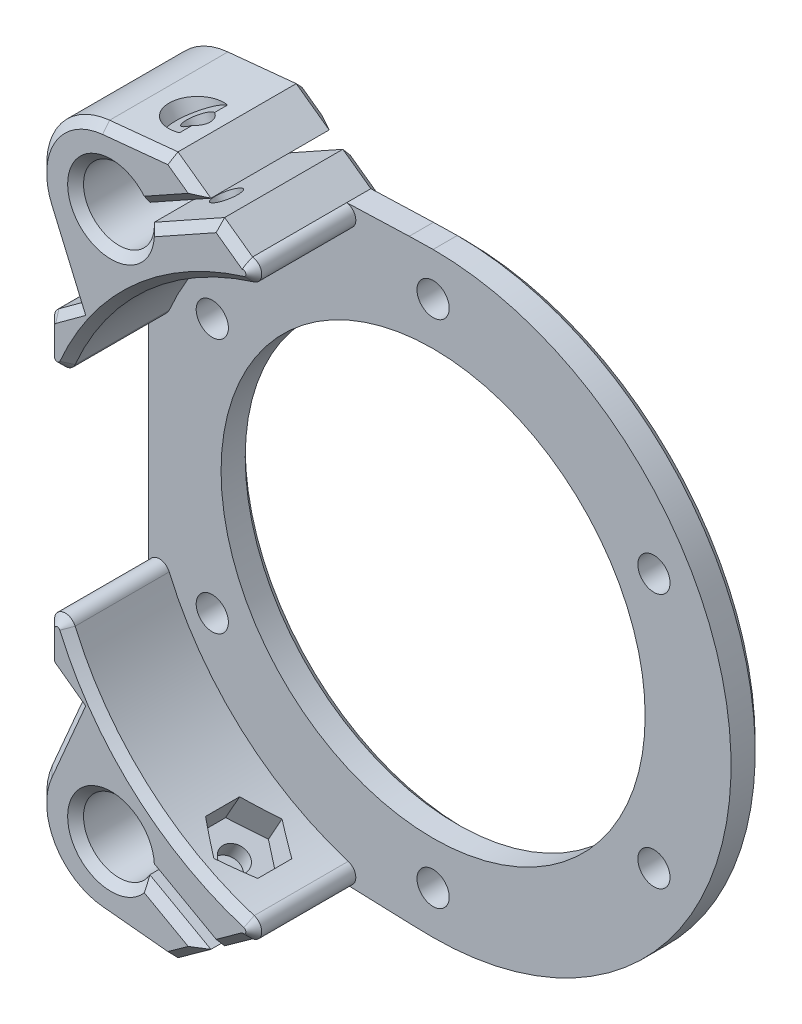
from build123d import *

# Parameters (mm, degrees)
SKETCH1_R           = 3.0000000000000004
SKETCH1_R_2         = 19.75
SKETCH1_R_3         = 19.749999999999996
BOSS_EXTRUDE1_DEPTH = 3
CUT_EXTRUDE1_DEPTH  = 85.92239104029044
SKETCH3_R           = 3.2999999999999914
BOSS_EXTRUDE2_DEPTH = 3
FILLET1_R           = 6.5
SKETCH4_R           = 1.5000000000000042
SKETCH4_R_2         = 1.4999999999999973
SKETCH4_R_3         = 1.5000000000000009
CUT_EXTRUDE2_DEPTH  = 86.57976596763909
SKETCH5_W           = 197.96063853035466
SKETCH5_H           = 105.83016834927265
CUT_EXTRUDE3_DEPTH  = 86.57976596763909
SKETCH6_R           = 3.2999999999999914
BOSS_EXTRUDE3_DEPTH = 9.5
FILLET2_R           = 1
CUT_EXTRUDE4_DEPTH  = 85.71619587231169
CUT_EXTRUDE5_START  = 10
SKETCH8_R           = 1.2000000000000004
CUT_EXTRUDE5_DEPTH  = 18.00000000000001
CUT_EXTRUDE6_START  = 10
SKETCH9_R           = 2.3249999999999984
CUT_EXTRUDE6_DEPTH  = 4.5
CUT_EXTRUDE7_START  = -5
CUT_EXTRUDE7_DEPTH  = 3.5
CHAMFER1_SIZE       = 0.75
CHAMFER2_SIZE       = 0.74


with BuildPart() as part:
    # Sketch1 → Boss-Extrude1 (new body)
    with BuildSketch(Plane.XY):
        Polygon((0, 36.75), (-10.000000000000002, 33.333681382493936), (-15.000000000000002, 29.000000000000007), (-58.050000000000004, 27.499999999999993), (-76.5, 14), (-76.5, -14), (-58.050000000000004, -27.500000000000007), (-14.999999999999998, -28.999999999999993), (-9.99999999999998, -33.333681382493936), (0, -36.75), (9.999999999999998, -33.333681382493936), (15.000000000000002, -28.999999999999996), (58.050000000000004, -27.500000000000007), (76.5, -14), (76.5, 14), (58.050000000000004, 27.499999999999993), (14.999999999999998, 29.000000000000007), (9.999999999999998, 33.333681382493936), align=None)
        with Locations((0, 30)):
            Circle(SKETCH1_R, mode=Mode.SUBTRACT)
        with Locations((-49.99999999999999, 0)):
            Circle(SKETCH1_R_2, mode=Mode.SUBTRACT)
        with Locations(Location((50.00000000000001, 1.225e-14, 0), (0, 0, 180))):
            Circle(SKETCH1_R_3, mode=Mode.SUBTRACT)
        with Locations(Location((0, -30, 0), (0, 0, 180))):
            Circle(SKETCH1_R, mode=Mode.SUBTRACT)
    extrude(amount=BOSS_EXTRUDE1_DEPTH)

    # Sketch2 → Cut-Extrude1 (cut, through all)
    with BuildSketch(Plane.XY.offset(3)):
        with BuildLine():
            Line((8.5, 20.000000000000007), (-8.5, 20))
            ThreePointArc((-8.5, 20), (-11.32842712474619, 18.82842712474619), (-12.5, 16))
            Line((-12.5, 16), (-12.499999999999996, -16))
            ThreePointArc((-12.499999999999996, -16), (-11.328427124746181, -18.828427124746188), (-8.499999999999993, -19.999999999999996))
            Line((-8.499999999999993, -19.999999999999996), (8.500000000000007, -19.999999999999996))
            ThreePointArc((8.500000000000007, -19.999999999999996), (11.328427124746195, -18.828427124746185), (12.500000000000004, -15.999999999999996))
            Line((12.500000000000004, -15.999999999999996), (12.5, 16.000000000000004))
            ThreePointArc((12.5, 16.000000000000004), (11.328427124746193, 18.828427124746195), (8.5, 20.000000000000007))
        make_face()
    extrude(amount=-CUT_EXTRUDE1_DEPTH, mode=Mode.SUBTRACT)

    # Sketch3 → Boss-Extrude2 (add)
    # profile 1 of 4: a face of its own
    with BuildSketch(Plane.XY.offset(3)):
        Polygon((-58.049999999999955, 27.50000000000001), (-65, 32.5), (-80.20458006493874, 31), (-73.76666666666668, 16), align=None)
        with Locations((-70.5, 25.5)):
            Circle(SKETCH3_R, mode=Mode.SUBTRACT)
    # profile 2 of 4: a face of its own
    with BuildSketch(Plane.XY.offset(3)):
        Polygon((73.76666666666668, 16), (58.049999999999955, 27.50000000000001), (65, 32.5), (80.20458006493874, 31), align=None)
        with Locations(Location((70.5, 25.5, 0), (0, 0, 180))):
            Circle(SKETCH3_R, mode=Mode.SUBTRACT)
    # profile 3 of 4: a face of its own
    with BuildSketch(Plane.XY.offset(3)):
        Polygon((58.04999999999996, -27.499999999999996), (65, -32.5), (80.20458006493874, -31), (73.76666666666668, -16), align=None)
        with Locations((70.5, -25.5)):
            Circle(SKETCH3_R, mode=Mode.SUBTRACT)
    # profile 4 of 4: a face of its own
    with BuildSketch(Plane.XY.offset(3)):
        Polygon((-73.76666666666668, -16), (-58.04999999999996, -27.499999999999996), (-65, -32.5), (-80.20458006493874, -31), align=None)
        with Locations(Location((-70.5, -25.5, 0), (0, 0, 180))):
            Circle(SKETCH3_R, mode=Mode.SUBTRACT)
    extrude(amount=-BOSS_EXTRUDE2_DEPTH)

    # Fillet1
    fillet1_edges = [part.edges().sort_by_distance(p)[0] for p in [
        (80.20458006493874, 31, 1.5),
        (80.20458006493874, -31, 1.5),
        (-80.20458006493874, -31, 1.5),
        (-80.20458006493874, 31, 1.5),
    ]]
    fillet(fillet1_edges, radius=FILLET1_R)

    # Sketch4 → Cut-Extrude2 (cut, through all)
    with BuildSketch(Plane.XY.offset(3)):
        with Locations((-49.99999999999999, 23.750000000000004)):
            Circle(SKETCH4_R)
        with Locations((-70.56810333987994, 11.87499999999908)):
            Circle(SKETCH4_R_2)
        with Locations((-70.56810333987887, -11.875000000000975)):
            Circle(SKETCH4_R_2)
        with Locations((-49.99999999999782, -23.750000000000007)):
            Circle(SKETCH4_R)
        with Locations((-29.43189666011796, -11.874999999998934)):
            Circle(SKETCH4_R_3)
        with Locations((-29.431896660119207, 11.875000000001107)):
            Circle(SKETCH4_R_3)
        with Locations(Location((29.431896660119207, 11.875000000001135, 0), (0, 0, 180))):
            Circle(SKETCH4_R_3)
        with Locations(Location((29.43189666011796, -11.874999999998908, 0), (0, 0, 180))):
            Circle(SKETCH4_R_3)
        with Locations(Location((49.99999999999782, -23.74999999999995, 0), (0, 0, 180))):
            Circle(SKETCH4_R)
        with Locations(Location((70.56810333987887, -11.875000000000947, 0), (0, 0, 180))):
            Circle(SKETCH4_R_2)
        with Locations(Location((70.56810333987994, 11.874999999999108, 0), (0, 0, 180))):
            Circle(SKETCH4_R_2)
        with Locations(Location((49.99999999999999, 23.750000000000018, 0), (0, 0, 180))):
            Circle(SKETCH4_R)
    extrude(amount=-CUT_EXTRUDE2_DEPTH, mode=Mode.SUBTRACT)

    # Sketch5 → Cut-Extrude3 (cut, through all)
    with BuildSketch(Plane.XY.offset(3)):
        with Locations((0.3552116574092139, 3.981612293671432)):
            Rectangle(SKETCH5_W, SKETCH5_H)
        with BuildLine():
            Line((-57.9916003006876, 27.58117558204423), (-49.99999999999999, 27.75))
            ThreePointArc((-49.99999999999999, 27.75), (-22.249999999999993, 0), (-49.99999999999999, -27.75))
            Line((-49.99999999999999, -27.75), (-57.9916003006876, -27.58117558204423))
            Line((-57.9916003006876, -27.58117558204423), (-64.97224681389281, -32.60322343327101))
            Line((-64.97224681389281, -32.60322343327101), (-71.37707367587572, -31.971358544405817))
            ThreePointArc((-71.37707367587572, -31.971358544405817), (-76.41184285047038, -28.75979430133998), (-76.79408844603512, -22.800185771120987))
            Line((-76.79408844603512, -22.800185771120987), (-73.88995261365207, -16.033701851433918))
            Line((-73.88995261365207, -16.033701851433918), (-76.55905099943843, -14.080703032565845))
            Line((-76.55905099943843, -14.080703032565845), (-76.5, 0))
            Line((-76.5, 0), (-76.55905099943843, 14.080703032565845))
            Line((-76.55905099943843, 14.080703032565845), (-73.88995261365207, 16.033701851433918))
            Line((-73.88995261365207, 16.033701851433918), (-76.79408844603512, 22.800185771120987))
            ThreePointArc((-76.79408844603512, 22.800185771120987), (-76.41184285047038, 28.75979430133998), (-71.37707367587572, 31.971358544405817))
            Line((-71.37707367587572, 31.971358544405817), (-64.97224681389281, 32.60322343327101))
            Line((-64.97224681389281, 32.60322343327101), (-57.9916003006876, 27.58117558204423))
        make_face(mode=Mode.SUBTRACT)
    extrude(amount=-CUT_EXTRUDE3_DEPTH, mode=Mode.SUBTRACT)

    # Sketch6 → Boss-Extrude3 (add)
    # profile 1 of 2: a face of its own
    with BuildSketch(Plane.XY.offset(3)):
        with BuildLine():
            Line((-76.70219467741117, 22.839626046070443), (-73.76666666666668, 16))
            Line((-73.76666666666668, 16), (-76.5, 14))
            Line((-76.5, 14), (-76.5, 3.648629879831583))
            ThreePointArc((-76.5, 3.648629879831583), (-67.5778504191284, 20.163870527325532), (-49.99999999999999, 26.75))
            Line((-49.99999999999999, 26.75), (-58.050000000000004, 27.499999999999993))
            Line((-58.050000000000004, 27.499999999999993), (-65, 32.5))
            Line((-65, 32.5), (-71.36725588861782, 31.87184165612369))
            ThreePointArc((-71.36725588861782, 31.87184165612369), (-76.32574068177924, 28.708937477346726), (-76.70219467741117, 22.839626046070443))
        make_face()
        with Locations((-70.5, 25.5)):
            Circle(SKETCH6_R, mode=Mode.SUBTRACT)
    # profile 2 of 2: a face of its own
    with BuildSketch(Plane.XY.offset(3)):
        with BuildLine():
            Line((-76.5, -14), (-76.5, -3.6486298798315886))
            ThreePointArc((-76.5, -3.6486298798315886), (-67.5778504191284, -20.163870527325543), (-49.999999999999986, -26.75))
            Line((-49.999999999999986, -26.75), (-58.050000000000004, -27.499999999999993))
            Line((-58.050000000000004, -27.499999999999993), (-64.99999999999999, -32.5))
            Line((-64.99999999999999, -32.5), (-71.3672558886178, -31.87184165612369))
            ThreePointArc((-71.3672558886178, -31.87184165612369), (-76.32574068177924, -28.708937477346737), (-76.70219467741117, -22.839626046070446))
            Line((-76.70219467741117, -22.839626046070446), (-73.76666666666668, -16.000000000000007))
            Line((-73.76666666666668, -16.000000000000007), (-76.5, -14))
        make_face()
        with Locations(Location((-70.5, -25.500000000000004, 0), (0, 0, 180))):
            Circle(SKETCH6_R, mode=Mode.SUBTRACT)
    extrude(amount=BOSS_EXTRUDE3_DEPTH)

    # Fillet2
    # the kernel refuses this fillet: 1 mm, written as the material it takes off along each edge
    with BuildSketch(Plane(origin=(-49.999999999999986, -26.750000000000004, 3), x_dir=(-0.9887761583970414, 0.14940451327047904, 0), z_dir=(0, 0, 1))) as fillet2_piece_1:
        with BuildLine():
            CenterArc((8.142545973241123, 0.9887761583970428), FILLET2_R, 107.15461611691443, 154.252965064784)
            Line((7.847594690143343, 1.9442884506251294), (0, 0))
            ThreePointArc((0, 0), (3.9965707299853213, 0.30023776287914367), (7.9931414599706425, 1e-17))
        make_face()
    extrude(amount=29.712155995835815, mode=Mode.SUBTRACT)
    with BuildSketch(Plane(origin=(-76.5, -3.6486298798315886, 3), x_dir=(0.2678344389516736, -0.9634649517815592, 0), z_dir=(0, 0, 1))) as fillet2_piece_2:
        with BuildLine():
            CenterArc((7.2984884614331, -0.9909925218324608), FILLET2_R, 97.69601260763352, 156.7685434949926)
            Line((7.030654022481427, -1.9544574736140201), (0, 0))
            ThreePointArc((0, 0), (3.582285620978633, -0.24095004098166345), (7.1645712419572645, 1.9e-16))
        make_face()
    extrude(amount=27.74314939915802, mode=Mode.SUBTRACT)
    with BuildSketch(Plane(origin=(-49.999999999999986, 26.75, 3), x_dir=(-0.9956879416597751, 0.09276595729749348, 0), z_dir=(0, 0, 1))) as fillet2_piece_3:
        with BuildLine():
            CenterArc((8.141371289440952, 0.9984020959642962), FILLET2_R, 112.50758834437129, 154.2529650647851)
            ThreePointArc((7.758565500354502, 1.9222309371691508), (3.951485440346435, 0.6696888298038981), (0, 0))
            Line((0, 0), (8.084862398334327, -6e-17))
        make_face()
    extrude(amount=29.712155995835815, mode=Mode.SUBTRACT)
    with BuildSketch(Plane(origin=(-76.5, 3.6486298798315833, 3), x_dir=(0.2678344389516734, 0.9634649517815593, 0), z_dir=(0, 0, 1))) as fillet2_piece_4:
        with BuildLine():
            CenterArc((7.298488461433108, 0.9909925218324613), FILLET2_R, 105.53544389737382, 156.76854349499257)
            Line((7.030654022481436, 1.9544574736140212), (0, 0))
            ThreePointArc((0, 0), (3.5822856209786367, 0.2409500409816637), (7.164571241957271, -1.3e-16))
        make_face()
    extrude(amount=27.743149399158046, mode=Mode.SUBTRACT)
    with BuildSketch(Plane(origin=(-76.5, -14, -1.268508730702571), x_dir=(0.8070303256584309, -0.5905099943842163, 0), z_dir=(0, 0, 1))) as fillet2_piece_5:
        with BuildLine():
            CenterArc((FILLET2_R * 0.507403492281, FILLET2_R), FILLET2_R, 216.19320730556473, 53.80679269443499)
            Line((-FILLET2_R * 0.299626833377, FILLET2_R * 0.409490005616), (0, 0))
            Line((0, 0), (FILLET2_R * 0.507403492281, 3e-17))
        make_face()
    extrude(amount=15.037017461405144, mode=Mode.SUBTRACT)
    with BuildSketch(Plane(origin=(-76.5, 13.999999999999996, -1.268508730702571), x_dir=(0, -1, 0), z_dir=(0, 0, 1))) as fillet2_piece_6:
        with BuildLine():
            CenterArc((FILLET2_R * 0.507403492281, FILLET2_R), FILLET2_R, 216.19320730556493, 53.8067926944351)
            Line((-FILLET2_R * 0.299626833377, FILLET2_R * 0.409490005616), (0, 0))
            Line((0, 0), (FILLET2_R * 0.507403492281, 0))
        make_face()
    extrude(amount=15.037017461405144, mode=Mode.SUBTRACT)

    # Sketch7 → Cut-Extrude4 (cut, through all)
    with BuildSketch(Plane.XY.offset(12.5)):
        Polygon((-68.72990303754605, 26.501333699254644), (-57.451877020110466, 32.796780579868035), (-56.75711876399617, 31.55215063748628), (-67.98850095769365, 25.282740557479496), align=None)
        Polygon((-67.98850095769365, -25.282740557479496), (-68.72990303754605, -26.501333699254644), (-57.451877020110466, -32.796780579868035), (-56.75711876399617, -31.55215063748628), align=None)
    extrude(amount=-CUT_EXTRUDE4_DEPTH, mode=Mode.SUBTRACT)

    # Sketch8 → Cut-Extrude5 (cut)
    with BuildSketch(Plane(origin=(-26.912054995734096, 48.21180484569098, 0), x_dir=(0.8731734941880153, 0.48740952908975016, 0), z_dir=(-0.48740952908975016, 0.8731734941880153, 0)).offset(CUT_EXTRUDE5_START)):
        with Locations(Location((-43.04149818074502, -7.75, 0), (0, 0, 180))):
            Circle(SKETCH8_R)
    cut_extrude5 = extrude(amount=-CUT_EXTRUDE5_DEPTH, mode=Mode.SUBTRACT)

    # Sketch9 → Cut-Extrude6 (cut)
    with BuildSketch(Plane(origin=(-26.912054995734096, 48.21180484569098, 0), x_dir=(0.8731734941880153, 0.48740952908975016, 0), z_dir=(-0.48740952908975016, 0.8731734941880153, 0)).offset(CUT_EXTRUDE6_START)):
        with Locations((-43.041498180745016, -7.75)):
            Circle(SKETCH9_R)
    cut_extrude6 = extrude(amount=-CUT_EXTRUDE6_DEPTH, mode=Mode.SUBTRACT)

    # Sketch10 → Cut-Extrude7 (cut)
    with BuildSketch(Plane(origin=(-26.912054995734096, 48.21180484569098, 0), x_dir=(0.8731734941880153, 0.48740952908975016, 0), z_dir=(-0.48740952908975016, 0.8731734941880153, 0)).offset(CUT_EXTRUDE7_START)):
        Polygon((-43.04149818074503, -4.574573519457059), (-45.79149818074502, -6.162286759728539), (-45.791498180745016, -9.33771324027149), (-43.04149818074502, -10.925426480542948), (-40.29149818074501, -9.33771324027146), (-40.291498180745016, -6.162286759728522), align=None)
    cut_extrude7 = extrude(amount=CUT_EXTRUDE7_DEPTH, mode=Mode.SUBTRACT)

    # Mirror1: Cut-Extrude5, Cut-Extrude6, Cut-Extrude7 across plane
    add(cut_extrude5.mirror(Plane.ZX), mode=Mode.SUBTRACT)
    add(cut_extrude6.mirror(Plane.ZX), mode=Mode.SUBTRACT)
    add(cut_extrude7.mirror(Plane.ZX), mode=Mode.SUBTRACT)

    # Chamfer1
    chamfer1_edges = [part.edges().sort_by_distance(p)[0] for p in [
        (-59.35337442360563, 28.437679441442935, 0),
        (-75.23443067203893, -19.419813023035218, 0),
        (-63.467232446629296, -31.39728952994914, 0),
        (-68.18362794430891, -32.185920828061846, 0),
        (-75.23443067203893, 19.419813023035218, 0),
        (-76.32574068177924, 28.70893747734672, 0),
        (-76.32574068177924, -28.708937477346726, 0),
        (-30.931896660119207, 11.875000000001107, 0),
        (-30.93189666011796, -11.874999999998934, 0),
        (-51.499999999997826, -23.750000000000007, 0),
        (-55.136235810883896, -27.6015248846382, 0),
        (-72.06810333987887, -11.875000000000975, 0),
        (-72.06810333987994, 11.87499999999908, 0),
        (-51.5, 23.750000000000004, 0),
        (-55.136235810883576, 27.601524884638195, 0),
        (-51.11123581088389, -27.726524884638195, 0),
        (-22.249999999999993, -5.1e-15, 0),
        (-51.111235810883564, 27.726524884638206, 0),
        (-74.92858833052546, -15.14981341668869, 0),
        (-76.5, 1.78e-15, 0),
        (-76.39177070886642, 13.945084079711744, 0),
        (-76.39177070886643, -13.945084079711714, 0),
        (-69.75, 2.42e-15, 0),
        (-73.66268115589936, -24.557955464896178, 0),
        (-59.353374423605636, -28.437679441442924, 0),
        (-73.66268115589936, 24.557955464896178, 0),
        (-63.467232446629296, 31.39728952994914, 0),
        (-64.77932615180292, 28.70656419735117, -1.78e-15),
        (-63.932006221037156, 27.54709489543086, 0),
        (-63.93200622103716, -27.54709489543086, 0),
        (-64.77932615180292, -28.706564197351167, -1.78e-15),
        (-74.92858833052546, 15.149813416688687, 0),
        (-68.18362794430892, 32.18592082806184, 0),
    ]]
    chamfer(chamfer1_edges, length=CHAMFER1_SIZE)

    # Chamfer2
    chamfer2_edges = [part.edges().sort_by_distance(p)[0] for p in [
        (-76.32574068177924, 28.70893747734673, 12.5),
        (-75.23443067203893, 19.41981302303522, 12.5),
        (-74.92858833052546, 15.149813416688694, 12.5),
        (-59.35337442360567, 28.437679441442917, 12.5),
        (-68.18362794430891, 32.185920828061846, 12.5),
        (-76.32574068177924, -28.70893747734674, 12.5),
        (-68.1836279443089, -32.185920828061846, 12.5),
        (-63.467232446629296, -31.397289529949138, 12.5),
        (-75.23443067203893, -19.419813023035225, 12.5),
        (-74.92858833052546, -15.149813416688698, 12.5),
        (-76.5, -12.219243073606949, 12.5),
        (-76.5, 12.219243073606945, 12.5),
        (-67.8911548871302, -19.88640432065881, 12.5),
        (-75.70134681656256, -9.966369624661315, 12.5),
        (-57.20171264747254, -26.586320916940597, 12.5),
        (-76.39177070886643, -13.945084079711714, 12.5),
        (-67.89115488713114, 19.886404320657952, 12.5),
        (-75.70134681656255, 9.966369624661311, 12.5),
        (-57.201712647472505, 26.58632091693386, 12.5),
        (-76.39177070886642, 13.945084079711744, 12.5),
        (-59.353374423605665, -28.437679441442917, 12.5),
        (-73.66268115589936, -24.55795546489616, 12.5),
        (-64.77932615180292, -28.706564197351163, 12.5),
        (-63.93200622103715, -27.547094895430874, 12.5),
        (-63.4672324466293, 31.397289529949138, 12.5),
        (-73.66268115589936, 24.55795546489615, 12.5),
        (-63.93200622103715, 27.54709489543087, 12.5),
        (-64.77932615180292, 28.70656419735116, 12.5),
    ]]
    chamfer(chamfer2_edges, length=CHAMFER2_SIZE)


solid = part.part
